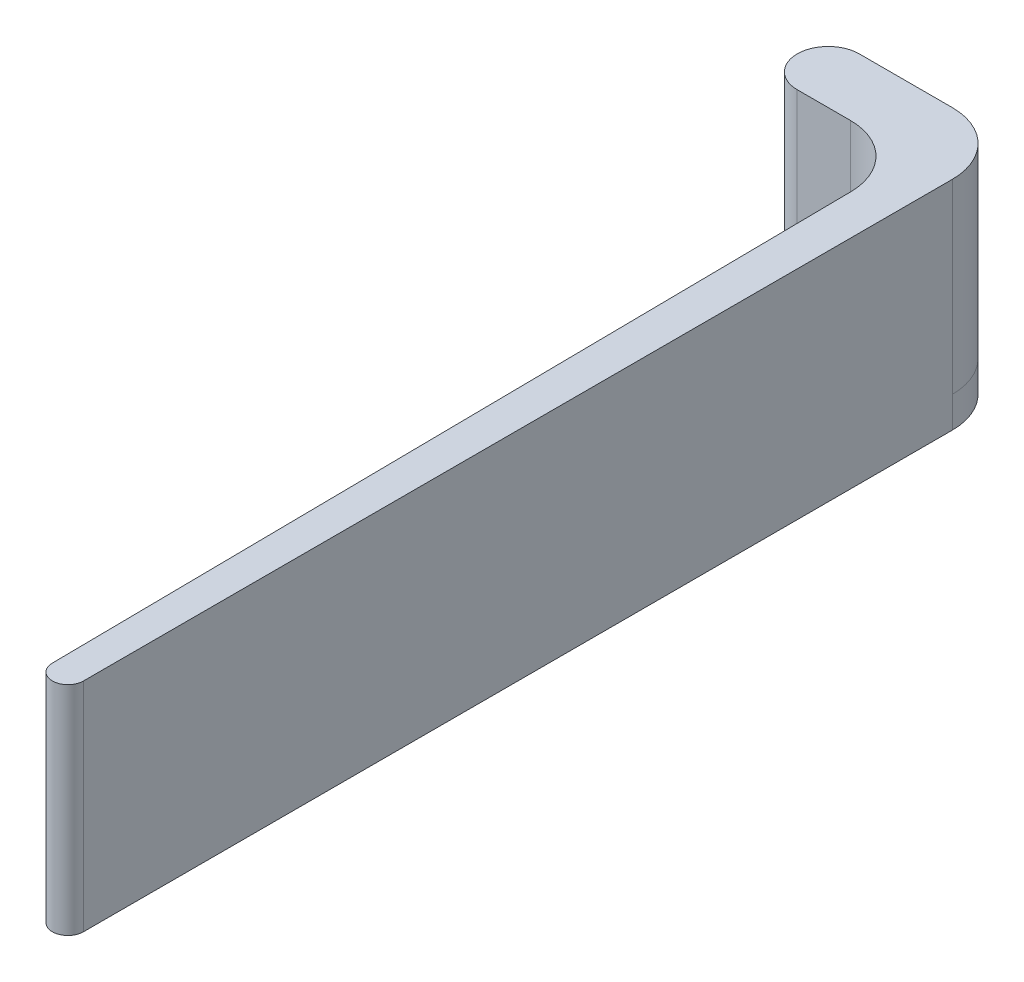
from build123d import *

# Parameters (mm, degrees)
BOSS_EXTRUDE2_DEPTH = 30
FILLET1_R           = 10
FILLET2_R           = 10
SKETCH2_R           = 3.747343823
BOSS_EXTRUDE3_DEPTH = 15
BOSS_EXTRUDE4_START = 5
BOSS_EXTRUDE4_DEPTH = 5
FILLET3_R           = 10


with BuildPart() as part:
    # Sketch1 → Boss-Extrude2 (new body)
    with BuildSketch(Plane(origin=(0, 0, 0), x_dir=(1, 0, 0), z_dir=(0, 1, 0))):
        with BuildLine():
            Line((0, 5), (25, 5))
            Line((25, 5), (25, -145))
            ThreePointArc((25, -145), (22.513876781, -147.499961487), (20.000154052, -145.027753135))
            Line((20.000154052, -145.027753135), (18.445574612, -5))
            Line((18.445574612, -5), (0, -5))
            ThreePointArc((0, -5), (-5, 0), (0, 5))
        make_face()
        Polygon((0.333439775, 2.639447604), (0, 3.05), (-0.333439775, 2.639447604), (-0.758504156, 2.954178641), (-0.979368078, 2.473601404), (-1.469348706, 2.672735374), (-1.563759083, 2.15232973), (-2.087868673, 2.223354314), (-2.049893354, 1.695819264), (-2.575200173, 1.634271725), (-2.407225286, 1.132754236), (-2.900722375, 0.942501833), (-2.6133024, 0.498514094), (-3.043981522, 0.191511085), (-2.655176114, -0.167049522), (-2.995976115, -0.571513009), (-2.530215347, -0.822116802), (-2.75972251, -1.298626839), (-2.246271844, -1.42552746), (-2.35006539, -1.944143169), (-1.821186821, -1.939366985), (-1.792745019, -2.467501833), (-1.281669931, -2.33134895), (-1.122779886, -2.835818282), (-0.661621006, -2.576843686), (-0.382266362, -3.025949839), (0, -2.660425857), (0.382266362, -3.025949839), (0.661621006, -2.576843686), (1.122779886, -2.835818282), (1.281669931, -2.33134895), (1.792745019, -2.467501833), (1.821186821, -1.939366985), (2.35006539, -1.944143169), (2.246271844, -1.42552746), (2.75972251, -1.298626839), (2.530215347, -0.822116802), (2.995976115, -0.571513009), (2.655176114, -0.167049522), (3.043981522, 0.191511085), (2.6133024, 0.498514094), (2.900722375, 0.942501833), (2.407225286, 1.132754236), (2.575200173, 1.634271725), (2.049893354, 1.695819264), (2.087868673, 2.223354314), (1.563759083, 2.15232973), (1.469348706, 2.672735374), (0.979368078, 2.473601404), (0.758504156, 2.954178641), align=None, mode=Mode.SUBTRACT)
    extrude(amount=BOSS_EXTRUDE2_DEPTH)

    # Fillet1
    fillet1_edges = [part.edges().sort_by_distance(p)[0] for p in [
        (18.445574612, 15, 5),
    ]]
    fillet(fillet1_edges, radius=FILLET1_R)

    # Fillet2
    fillet2_edges = [part.edges().sort_by_distance(p)[0] for p in [
        (25, 15, -5),
    ]]
    fillet(fillet2_edges, radius=FILLET2_R)

    # Sketch2 → Boss-Extrude3 (add)
    with BuildSketch(Plane(origin=(0, 30, 0), x_dir=(1, 0, 0), z_dir=(0, 1, 0))):
        Circle(SKETCH2_R)
    extrude(amount=-BOSS_EXTRUDE3_DEPTH)

    # Sketch3 → Boss-Extrude4 (add)
    with BuildSketch(Plane.XZ.offset(BOSS_EXTRUDE4_START)):
        with BuildLine():
            Line((20.000154052, 145.027753135), (18.34093441, -4.425399581))
            Line((18.34093441, -4.425399581), (25, -4.425399581))
            Line((25, -4.425399581), (25, 145))
            ThreePointArc((25, 145), (22.513876781, 147.499961487), (20.000154052, 145.027753135))
        make_face()
    extrude(amount=-BOSS_EXTRUDE4_DEPTH)

    # Fillet3
    # the kernel refuses this fillet: 10 mm, written as the material it takes off along each edge
    with BuildSketch(Plane(origin=(25, -28.563498953, -4.425399581), x_dir=(0, 0, 1), z_dir=(0, 1, 0))) as fillet3_piece_1:
        with BuildLine():
            CenterArc((9.425399581, -10), FILLET3_R, 90, 70.482580004)
            Line((0, -6.65906559), (-0.188507992, -6.592246902))
            ThreePointArc((-0.188507992, -6.592246902), (-0.2, -3.329532795), (-0.2, 0))
            Line((-0.2, 0), (0, 0.2))
            Line((0, 0.2), (9.425399581, 0.2))
            Line((9.425399581, 0.2), (9.425399581, 0))
        make_face()
    extrude(amount=52.126997906, mode=Mode.SUBTRACT)


solid = part.part
